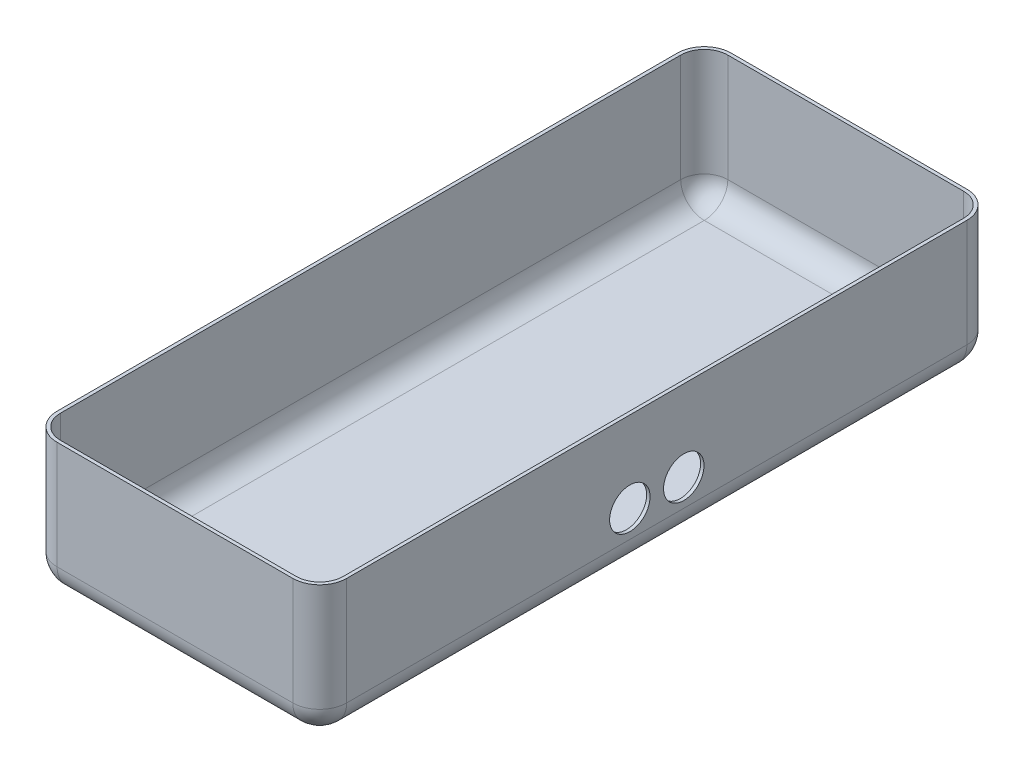
from build123d import *

# Parameters (mm, degrees)
SKETCH1_W           = 136.398
SKETCH1_H           = 317.5
BOSS_EXTRUDE1_DEPTH = 63.5
FILLET1_R           = 12.7
SHELL1_T            = -1.6002
CUT_EXTRUDE1_REACH  = 353.344
SKETCH2_R           = 9.525


with BuildPart() as part:
    # Sketch1 → Boss-Extrude1 (new body)
    with BuildSketch(Plane(origin=(0, 0, 0), x_dir=(1, 0, 0), z_dir=(0, 1, 0))):
        with Locations((68.199, 158.75)):
            Rectangle(SKETCH1_W, SKETCH1_H)
    extrude(amount=BOSS_EXTRUDE1_DEPTH)

    # Fillet1
    fillet1_edges = [part.edges().sort_by_distance(p)[0] for p in [
        (0, 0, -158.75),
        (0, 31.75, -317.5),
        (68.199, 0, -317.5),
        (136.398, 31.75, -317.5),
        (68.199, 0, 0),
        (136.398, 0, -158.75),
        (136.398, 31.75, 0),
        (0, 31.75, 0),
    ]]
    fillet(fillet1_edges, radius=FILLET1_R)

    # Shell1
    shell1_openings = [part.faces().sort_by_distance(p)[0] for p in [
        (68.199, 63.5, -158.75),
    ]]
    offset(amount=SHELL1_T, openings=shell1_openings, kind=Kind.INTERSECTION)

    # Sketch2 → Cut-Extrude1 (cut, up to next)
    with BuildSketch(Plane(origin=(136.398, 0, 0), x_dir=(0, 0, -1), z_dir=(1, 0, 0)), mode=Mode.PRIVATE) as cut_extrude1_sk1:
        with Locations((146.05, 25.4)):
            Circle(SKETCH2_R)
    cut_extrude1_tool1 = extrude(cut_extrude1_sk1.sketch, amount=-CUT_EXTRUDE1_REACH, mode=Mode.PRIVATE) & part.part
    # Sketch2 → Cut-Extrude1 (cut, up to next)
    with BuildSketch(Plane(origin=(136.398, 0, 0), x_dir=(0, 0, -1), z_dir=(1, 0, 0)), mode=Mode.PRIVATE) as cut_extrude1_sk2:
        with Locations((171.45, 25.4)):
            Circle(SKETCH2_R)
    cut_extrude1_tool2 = extrude(cut_extrude1_sk2.sketch, amount=-CUT_EXTRUDE1_REACH, mode=Mode.PRIVATE) & part.part
    add(cut_extrude1_tool1.solids().sort_by_distance((136.398, 25.4, -146.05))[0], mode=Mode.SUBTRACT)
    add(cut_extrude1_tool2.solids().sort_by_distance((136.398, 25.4, -171.45))[0], mode=Mode.SUBTRACT)


solid = part.part
